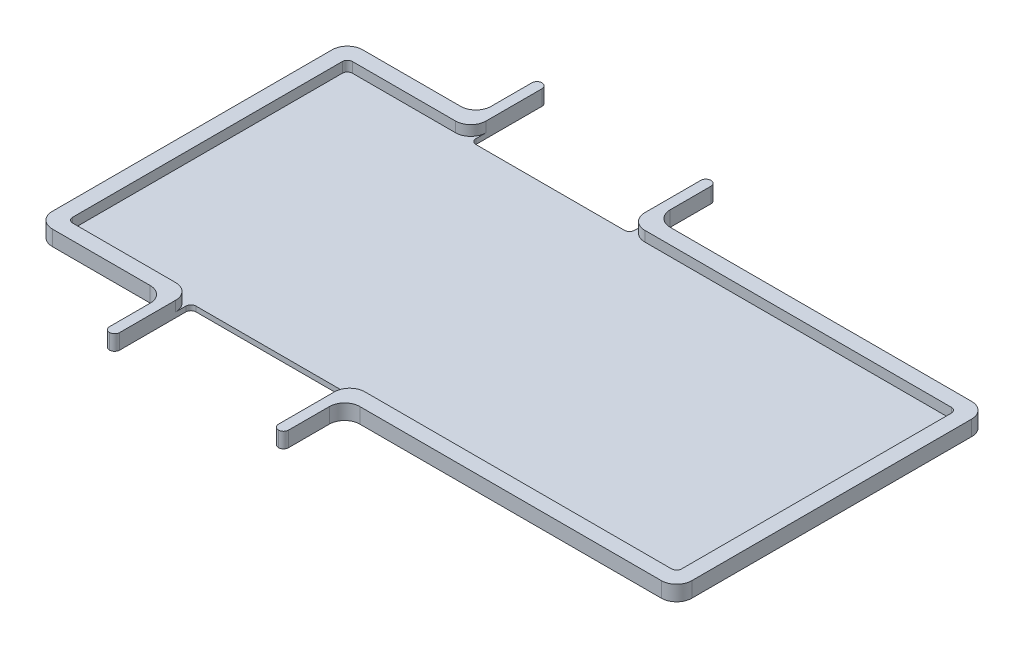
from build123d import *

# Parameters (mm, degrees)
BOSS_EXTRUDE6_DEPTH   = 3
BOSS_EXTRUDE6_2_DEPTH = 3
SKETCH4_W             = 119.7
SKETCH4_H             = 55
BOSS_EXTRUDE7_DEPTH   = 1
FILLET13_R            = 3
FILLET14_R            = 1
FILLET15_R            = 1
FILLET16_R            = 3
FILLET17_R            = 3
FILLET18_R            = 1
FILLET19_R            = 3
FILLET20_R            = 1


with BuildPart() as part:
    # Sketch3 → Boss-Extrude6 (new body)
    with BuildSketch(Plane(origin=(0, 0, 0), x_dir=(1, 0, 0), z_dir=(0, 1, 0))):
        Polygon((-35.6, -27.5), (-59.85, -27.5), (-59.85, 27.5), (-35.6, 27.5), (-35.6, 42.5), (-37.6, 42.5), (-37.6, 30.5), (-62.85, 30.5), (-62.85, -30.5), (-37.6, -30.5), (-37.6, -42.5), (-35.6, -42.5), align=None)
    extrude(amount=BOSS_EXTRUDE6_DEPTH)



with BuildPart() as body_2:
    # Sketch3 → Boss-Extrude6 2 (new body)
    with BuildSketch(Plane(origin=(0, 0, 0), x_dir=(1, 0, 0), z_dir=(0, 1, 0))):
        Polygon((59.85, -27.5), (-4.4, -27.5), (-4.4, -42.5), (-2.4, -42.5), (-2.4, -30.5), (62.85, -30.5), (62.85, 30.5), (-2.4, 30.5), (-2.4, 42.5), (-4.4, 42.5), (-4.4, 27.5), (59.85, 27.5), align=None)
    extrude(amount=BOSS_EXTRUDE6_2_DEPTH)


with BuildPart() as part_1:
    add(part.part)

    add(body_2.part)  # Boss-Extrude7 merges body 2
    # Sketch4 → Boss-Extrude7 (add)
    with BuildSketch(Plane(origin=(0, 0, 0), x_dir=(1, 0, 0), z_dir=(0, 1, 0))):
        Rectangle(SKETCH4_W, SKETCH4_H)
    extrude(amount=BOSS_EXTRUDE7_DEPTH)

    # Fillet13
    fillet13_edges = [part_1.edges().sort_by_distance(p)[0] for p in [
        (-62.85, 1.5, 30.5),
        (-62.85, 1.5, -30.5),
        (62.85, 1.5, 30.5),
        (62.85, 1.5, -30.5),
    ]]
    fillet(fillet13_edges, radius=FILLET13_R)

    # Fillet14
    fillet14_edges = [part_1.edges().sort_by_distance(p)[0] for p in [
        (-59.85, 2, -27.5),
        (-59.85, 2, 27.5),
        (59.85, 2, -27.5),
        (59.85, 2, 27.5),
    ]]
    fillet(fillet14_edges, radius=FILLET14_R)

    # Fillet15
    fillet15_edges = [part_1.edges().sort_by_distance(p)[0] for p in [
        (-2.4, 1.5, 42.5),
        (-4.4, 1.5, 42.5),
        (-35.6, 1.5, 42.5),
        (-37.6, 1.5, 42.5),
        (-35.6, 1.5, -42.5),
        (-37.6, 1.5, -42.5),
        (-2.4, 1.5, -42.5),
        (-4.4, 1.5, -42.5),
    ]]
    fillet(fillet15_edges, radius=FILLET15_R - 0.0001)  # a hair under: the kernel refuses the full size

    # Fillet16
    fillet16_edges = [part_1.edges().sort_by_distance(p)[0] for p in [
        (-37.6, 1.5, -30.5),
        (-37.6, 1.5, 30.5),
        (-2.4, 1.5, 30.5),
        (-2.4, 1.5, -30.5),
    ]]
    fillet(fillet16_edges, radius=FILLET16_R)

    # Fillet17
    fillet17_edges = [part_1.edges().sort_by_distance(p)[0] for p in [
        (-35.6, 2, -27.5),
        (-4.4, 2, -27.5),
    ]]
    fillet(fillet17_edges, radius=FILLET17_R)

    # Fillet18
    fillet18_edges = [part_1.edges().sort_by_distance(p)[0] for p in [
        (-35.6, 0.5, -27.5),
        (-4.4, 0.5, -27.5),
    ]]
    fillet(fillet18_edges, radius=FILLET18_R)

    # Fillet19
    fillet19_edges = [part_1.edges().sort_by_distance(p)[0] for p in [
        (-35.6, 2, 27.5),
        (-4.4, 2, 27.5),
    ]]
    fillet(fillet19_edges, radius=FILLET19_R)

    # Fillet20
    fillet20_edges = [part_1.edges().sort_by_distance(p)[0] for p in [
        (-35.6, 0.5, 27.5),
        (-4.4, 0.5, 27.5),
    ]]
    fillet(fillet20_edges, radius=FILLET20_R)


solid = part_1.part
